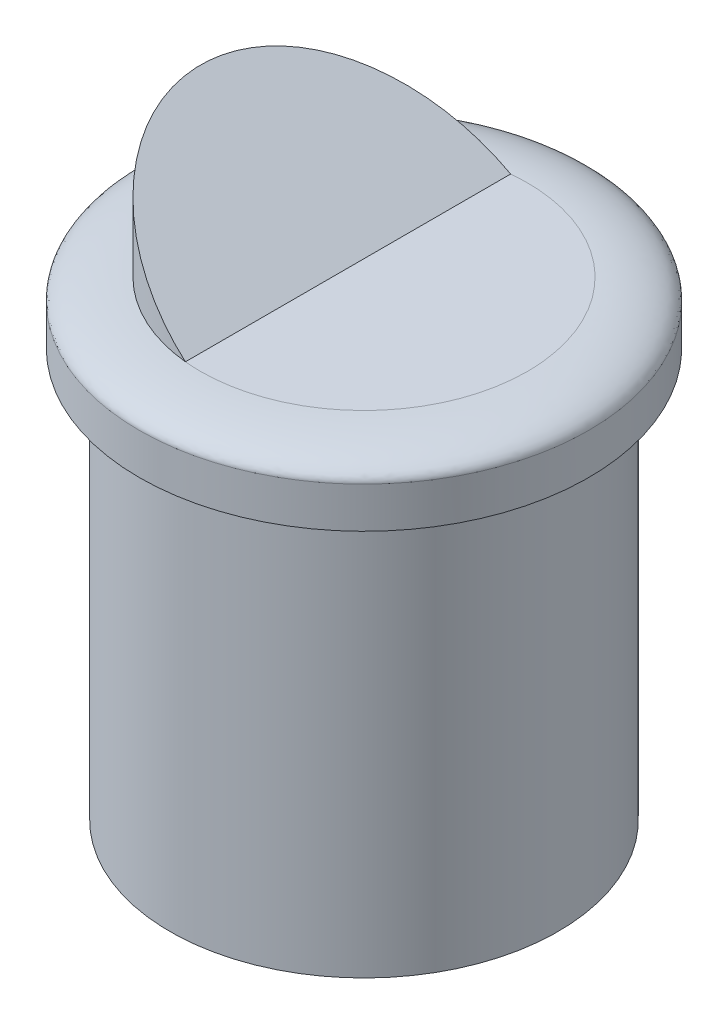
from build123d import *

# Parameters (mm, degrees)
SKETCH1_R           = 11
BOSS_EXTRUDE1_DEPTH = 3
SKETCH2_R           = 9.5
BOSS_EXTRUDE2_DEPTH = 20
FILLET1_SIZE        = 1
FILLET1_SIZE_2      = 3
BOSS_EXTRUDE3_DEPTH = 5
CUT_EXTRUDE1_DEPTH  = 17.5


with BuildPart() as part:
    # Sketch1 → Boss-Extrude1 (new body)
    with BuildSketch(Plane(origin=(0, 0, 0), x_dir=(1, 0, 0), z_dir=(0, 1, 0))):
        with Locations(Location((0, 0, 0), (0, 0, 270))):
            Circle(SKETCH1_R)
    extrude(amount=BOSS_EXTRUDE1_DEPTH)

    # Sketch2 → Boss-Extrude2 (add)
    with BuildSketch(Plane.XZ):
        with Locations(Location((0, 0, 0), (0, 0, 270))):
            Circle(SKETCH2_R)
    extrude(amount=BOSS_EXTRUDE2_DEPTH)

    # Fillet1
    # an asymmetric fillet: 3, 1 mm, written as the material it takes off along each edge
    with BuildSketch(Plane(origin=(0, 3, 0), x_dir=(0, 0, 1), z_dir=(-1, 0, 0))) as fillet1_piece_1:
        with BuildLine():
            Bezier((11, -FILLET1_SIZE), (11, 0), (11 - FILLET1_SIZE_2, 0), weights=[1, 0.707106781, 1])
            Line((11 - FILLET1_SIZE_2, 0), (11, 0))
            Line((11, 0), (11, -FILLET1_SIZE))
        make_face()
    revolve(axis=Axis((0, 3, 0), (0, 1, 0)), mode=Mode.SUBTRACT)

    # Sketch4 → Boss-Extrude3 (add)
    with BuildSketch(Plane(origin=(0, 3, 0), x_dir=(1, 0, 0), z_dir=(0, 1, 0))):
        with BuildLine():
            add(Edge.make_bspline(
                [(0, -8), (0.523594432, -8), (1.570783296, -7.896860899), (3.081202271, -7.438680312), (4.473212371, -6.694635413), (5.693319428, -5.693319428), (6.694635413, -4.473212371), (7.438680312, -3.081202271), (7.896860899, -1.570783296), (8.05156955, 0), (7.896860899, 1.570783296), (7.438680312, 3.081202271), (6.694635413, 4.473212371), (5.693319428, 5.693319428), (4.473212371, 6.694635413), (3.081202271, 7.438680312), (1.570783296, 7.896860899), (0, 8.05156955), (-1.570783296, 7.896860899), (-3.081202271, 7.438680312), (-4.473212371, 6.694635413), (-5.693319428, 5.693319428), (-6.694635413, 4.473212371), (-7.438680312, 3.081202271), (-7.896860899, 1.570783296), (-8.05156955, 0), (-7.896860899, -1.570783296), (-7.438680312, -3.081202271), (-6.694635413, -4.473212371), (-5.693319428, -5.693319428), (-4.473212371, -6.694635413), (-3.081202271, -7.438680312), (-1.570783296, -7.896860899), (-0.523594432, -8), (0, -8)],
                knots=[0, 0, 0, 0, 0.03125, 0.0625, 0.09375, 0.125, 0.15625, 0.1875, 0.21875, 0.25, 0.28125, 0.3125, 0.34375, 0.375, 0.40625, 0.4375, 0.46875, 0.5, 0.53125, 0.5625, 0.59375, 0.625, 0.65625, 0.6875, 0.71875, 0.75, 0.78125, 0.8125, 0.84375, 0.875, 0.90625, 0.9375, 0.96875, 1, 1, 1, 1], degree=3))
        make_face()
    extrude(amount=BOSS_EXTRUDE3_DEPTH)

    # Sketch5 → Cut-Extrude1 (cut, symmetric)
    with BuildSketch(Plane.XY):
        Polygon((-8, 8), (-0.78125, 3), (8, 3), (8, 8), align=None)
    extrude(amount=CUT_EXTRUDE1_DEPTH, both=True, mode=Mode.SUBTRACT)


solid = part.part
